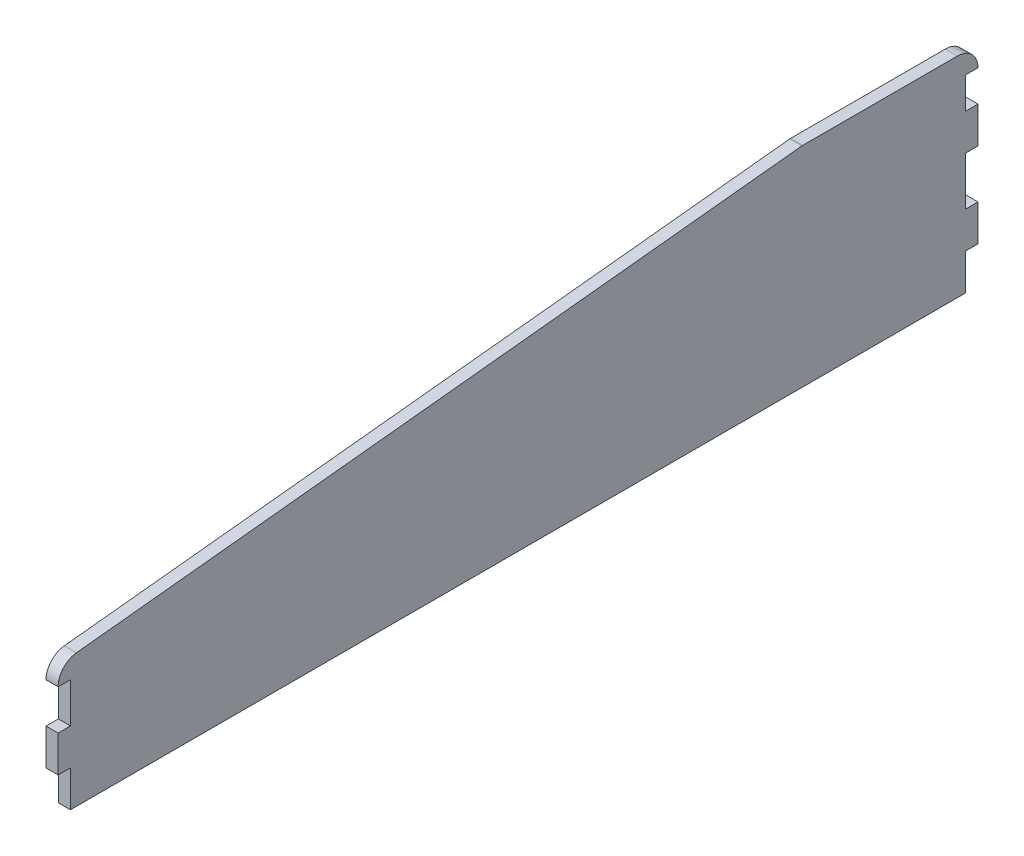
from build123d import *

# Parameters (mm, degrees)
BOSS_EXTRUDE1_DEPTH = 5


with BuildPart() as part:
    # Sketch26 → Boss-Extrude1 (new body)
    with BuildSketch(Plane(origin=(0, 0, 0), x_dir=(0, 0, -1), z_dir=(1, 0, 0))):
        with BuildLine():
            Line((-76.976453737, -179.679510109), (-76.559975172, -179.657683393))
            Line((-76.559975172, -179.657683393), (-12.65032895, -179.657683393))
            ThreePointArc((-12.65032895, -179.657683393), (-6.686906694, -182.127813769), (-4.216776317, -188.091236026))
            Line((-4.216776317, -188.091236026), (-9.296776317, -188.091236026))
            Line((-9.296776317, -188.091236026), (-9.296776317, -201.073056993))
            Line((-9.296776317, -201.073056993), (-4.216776317, -201.073056993))
            Line((-4.216776317, -201.073056993), (-4.216776317, -216.073056993))
            Line((-4.216776317, -216.073056993), (-9.296776317, -216.073056993))
            Line((-9.296776317, -216.073056993), (-9.296776317, -236.073056993))
            Line((-9.296776317, -236.073056993), (-4.216776317, -236.073056993))
            Line((-4.216776317, -236.073056993), (-4.216776317, -251.073056993))
            Line((-4.216776317, -251.073056993), (-9.296776317, -251.073056993))
            Line((-9.296776317, -251.073056993), (-9.296776317, -266.073056993))
            Line((-9.296776317, -266.073056993), (-378.962542621, -266.073056993))
            Line((-378.962542621, -266.073056993), (-378.962542621, -251.073056993))
            Line((-378.962542621, -251.073056993), (-384.042542621, -251.073056993))
            Line((-384.042542621, -251.073056993), (-384.042542621, -236.073056993))
            Line((-384.042542621, -236.073056993), (-378.962542621, -236.073056993))
            Line((-378.962542621, -236.073056993), (-378.962542621, -219.547061456))
            Line((-378.962542621, -219.547061456), (-384.042542621, -219.547061456))
            ThreePointArc((-384.042542621, -219.547061456), (-381.876340988, -213.903913269), (-376.490536285, -211.159708707))
            Line((-376.490536285, -211.159708707), (-76.976453737, -179.679510109))
        make_face()
    extrude(amount=-BOSS_EXTRUDE1_DEPTH)


solid = part.part
